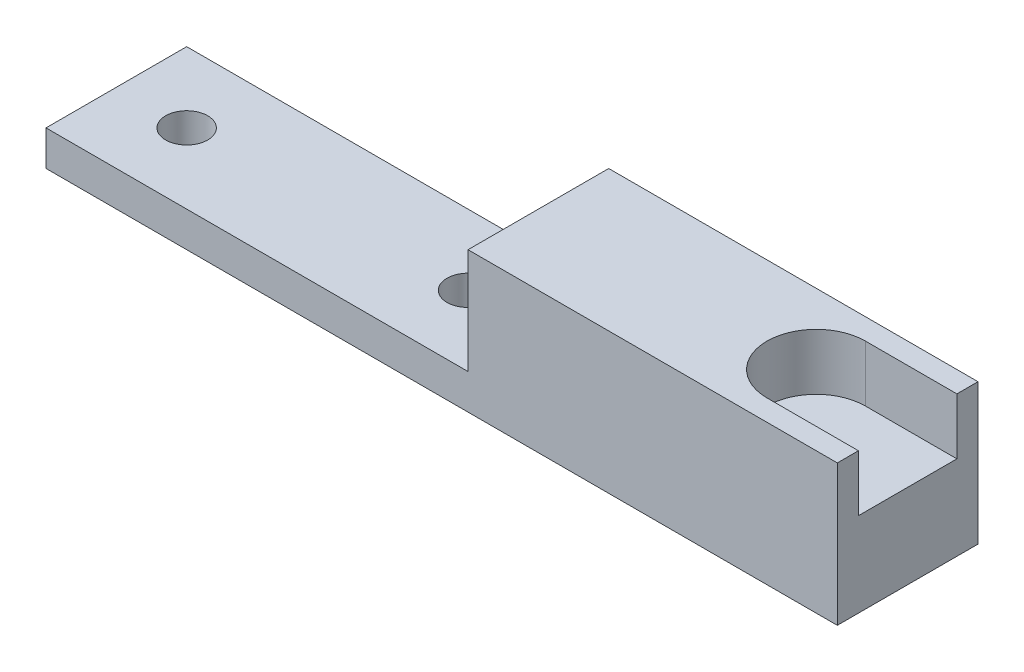
from build123d import *

# Parameters (mm, degrees)
SKETCH1_W             = 71.4375
SKETCH1_H             = 12.7
BOSS_EXTRUDE1_DEPTH   = 12.7
F_6_CLEARANCE_HOLE2_D = 3.7973
SKETCH6_W             = 38.1
SKETCH6_H             = 9.525
CUT_EXTRUDE1_DEPTH    = 40.980108824
CUT_EXTRUDE2_DEPTH    = 5.08


with BuildPart() as part:
    # Sketch1 → Boss-Extrude1 (new body)
    with BuildSketch(Plane(origin=(0, 0, 0), x_dir=(1, 0, 0), z_dir=(0, 1, 0))):
        Rectangle(SKETCH1_W, SKETCH1_H)
    extrude(amount=BOSS_EXTRUDE1_DEPTH)

    # #6 Clearance Hole2 (through all)
    with Locations(Plane(origin=(0, 0, 0), x_dir=(-1, 0, 0), z_dir=(0, -1, 0))):
        with Locations((29.36875, 0), (3.96875, 0)):
            Hole(F_6_CLEARANCE_HOLE2_D / 2)

    # Sketch6 → Cut-Extrude1 (cut, through all)
    with BuildSketch(Plane.XY.offset(6.35)):
        with Locations((-16.66875, 7.9375)):
            Rectangle(SKETCH6_W, SKETCH6_H)
    extrude(amount=-CUT_EXTRUDE1_DEPTH, mode=Mode.SUBTRACT)

    # Sketch8 → Cut-Extrude2 (cut)
    with BuildSketch(Plane(origin=(0, 12.7, 0), x_dir=(1, 0, 0), z_dir=(0, 1, 0))):
        with BuildLine():
            Line((35.71875, 4.445), (27.46375, 4.445))
            ThreePointArc((27.46375, 4.445), (23.01875, 0), (27.46375, -4.445))
            Line((27.46375, -4.445), (35.71875, -4.445))
            Line((35.71875, -4.445), (35.71875, 4.445))
        make_face()
    extrude(amount=-CUT_EXTRUDE2_DEPTH, mode=Mode.SUBTRACT)


solid = part.part
